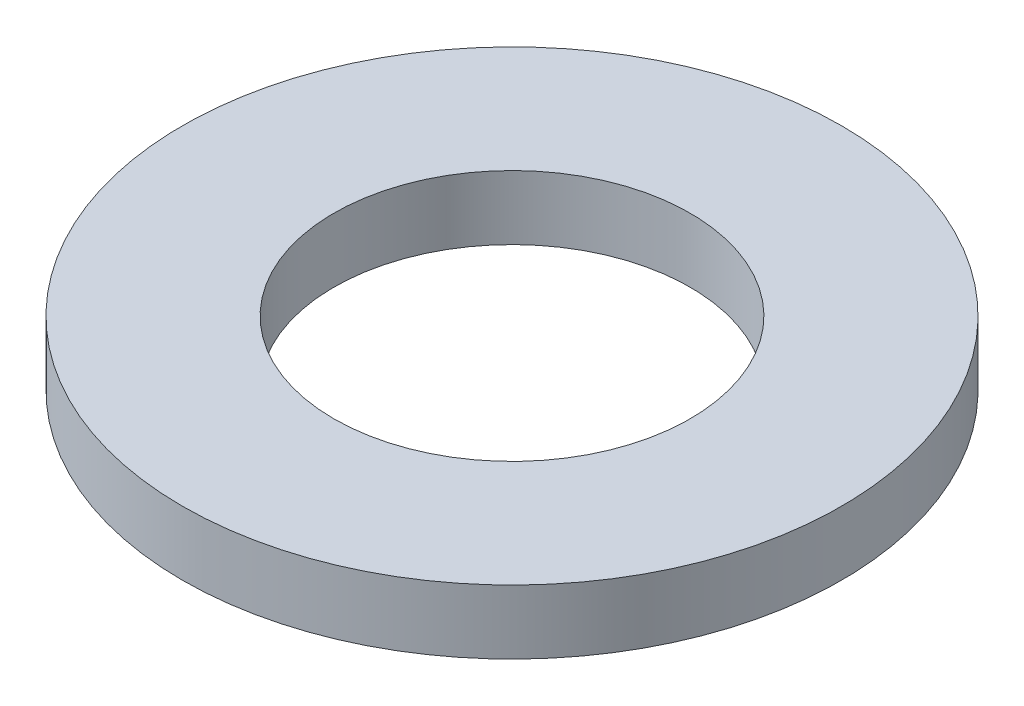
from build123d import *

# Parameters (mm, degrees)
SKETCH1_R           = 92.5
BOSS_EXTRUDE1_DEPTH = 18
SKETCH2_R           = 50
CUT_EXTRUDE1_DEPTH  = 133.047339996


with BuildPart() as part:
    # Sketch1 → Boss-Extrude1 (new body)
    with BuildSketch(Plane(origin=(0, 0, 0), x_dir=(1, 0, 0), z_dir=(0, 1, 0))):
        Circle(SKETCH1_R)
    extrude(amount=BOSS_EXTRUDE1_DEPTH)

    # Sketch2 → Cut-Extrude1 (cut, through all)
    with BuildSketch(Plane(origin=(0, 0, 0), x_dir=(1, 0, 0), z_dir=(0, 1, 0))):
        Circle(SKETCH2_R)
    extrude(amount=CUT_EXTRUDE1_DEPTH, mode=Mode.SUBTRACT)


solid = part.part
